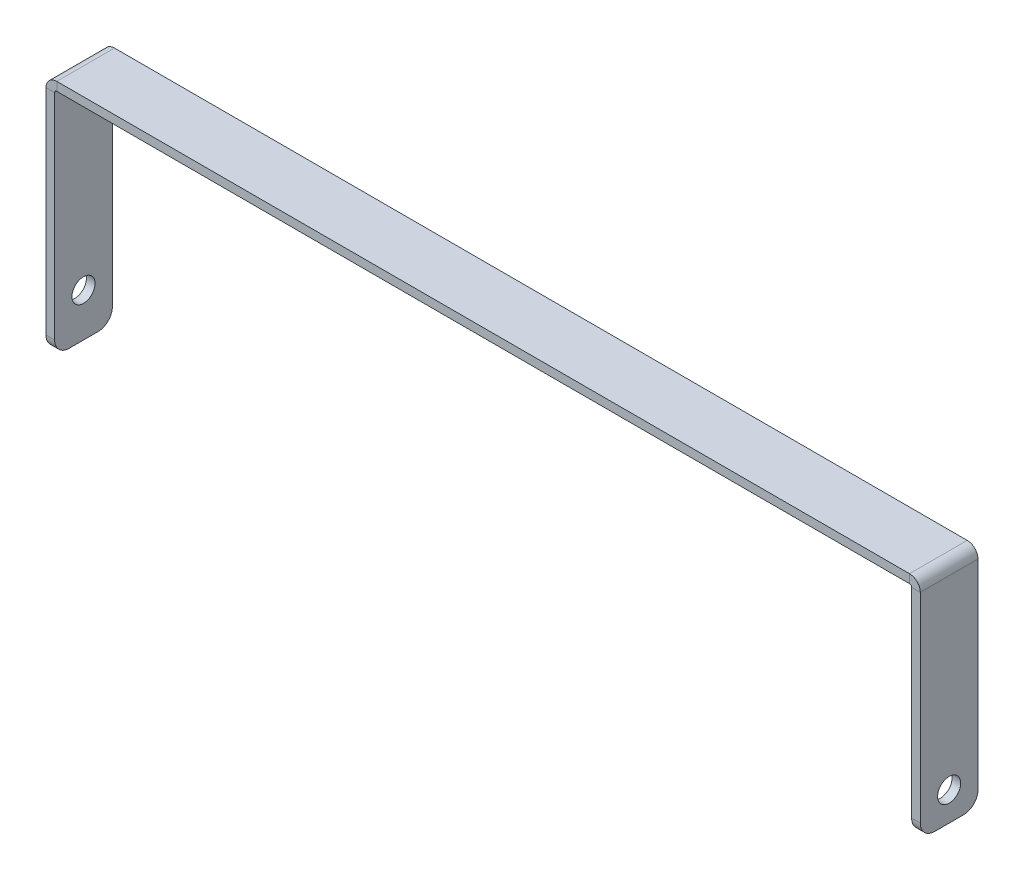
from build123d import *

# Parameters (mm, degrees)
BASE_FLANGE1_DEPTH = 10
SKETCH3_R          = 4
CUT_EXTRUDE1_DEPTH = 307.129466076
FILLET1_R          = 5


# Sheet-metal steps are written as plain solids
with BuildPart() as part:
    # Sketch1 → Base-Flange1 (new, symmetric)
    with BuildSketch(Plane.XY):
        with BuildLine():
            Line((-148.5, -42.5), (-148.5, 36.7634))
            ThreePointArc((-148.5, 36.7634), (-148.284254855, 37.284254855), (-147.7634, 37.5))
            Line((-147.7634, 37.5), (147.7634, 37.5))
            ThreePointArc((147.7634, 37.5), (148.284254855, 37.284254855), (148.5, 36.7634))
            Line((148.5, 36.7634), (148.5, -37.5))
            Line((148.5, -37.5), (151.5, -37.5))
            Line((151.5, -37.5), (151.5, 36.7634))
            ThreePointArc((151.5, 36.7634), (150.405575199, 39.405575199), (147.7634, 40.5))
            Line((147.7634, 40.5), (-147.7634, 40.5))
            ThreePointArc((-147.7634, 40.5), (-150.405575199, 39.405575199), (-151.5, 36.7634))
            Line((-151.5, 36.7634), (-151.5, -42.5))
            Line((-151.5, -42.5), (-148.5, -42.5))
        make_face()
    extrude(amount=BASE_FLANGE1_DEPTH, both=True)

    # Sketch3 → Cut-Extrude1 (cut, through all)
    with BuildSketch(Plane(origin=(151.5, 0, 0), x_dir=(0, 0, -1), z_dir=(1, 0, 0))):
        with Locations(Location((0, -27.5, 0), (0, 0, 90))):
            Circle(SKETCH3_R)
    extrude(amount=-CUT_EXTRUDE1_DEPTH, mode=Mode.SUBTRACT)

    # Fillet1
    fillet1_edges = [part.edges().sort_by_distance(p)[0] for p in [
        (150, -37.5, -10),
        (150, -37.5, 10),
        (-150, -42.5, -10),
        (-150, -42.5, 10),
    ]]
    fillet(fillet1_edges, radius=FILLET1_R)


solid = part.part
